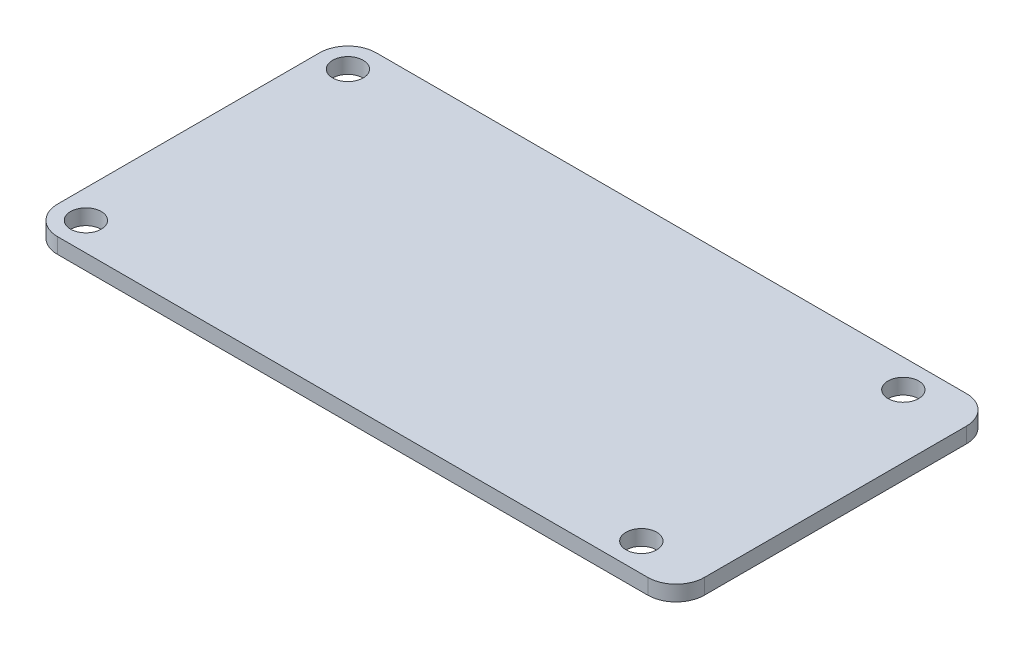
from build123d import *

# Parameters (mm, degrees)
SKETCH1_R           = 1.5875
BOSS_EXTRUDE1_DEPTH = 1.6


with BuildPart() as part:
    # Sketch1 → Boss-Extrude1 (new body)
    with BuildSketch(Plane(origin=(0, 0, 0), x_dir=(1, 0, 0), z_dir=(0, 1, 0))):
        with BuildLine():
            Line((-33.5, 13.57), (-33.5, -13.57))
            ThreePointArc((-33.5, -13.57), (-32.641822869, -15.641822869), (-30.57, -16.5))
            Line((-30.57, -16.5), (30.57, -16.5))
            ThreePointArc((30.57, -16.5), (32.641822869, -15.641822869), (33.5, -13.57))
            Line((33.5, -13.57), (33.5, 13.57))
            ThreePointArc((33.5, 13.57), (32.641822869, 15.641822869), (30.57, 16.5))
            Line((30.57, 16.5), (-30.57, 16.5))
            ThreePointArc((-30.57, 16.5), (-32.641822869, 15.641822869), (-33.5, 13.57))
        make_face()
        with Locations((-30.57, 13.57)):
            Circle(SKETCH1_R, mode=Mode.SUBTRACT)
        with Locations((26.97, 13.57)):
            Circle(SKETCH1_R, mode=Mode.SUBTRACT)
        with Locations((26.97, -13.57)):
            Circle(SKETCH1_R, mode=Mode.SUBTRACT)
        with Locations((-30.57, -13.57)):
            Circle(SKETCH1_R, mode=Mode.SUBTRACT)
    extrude(amount=BOSS_EXTRUDE1_DEPTH)


solid = part.part
